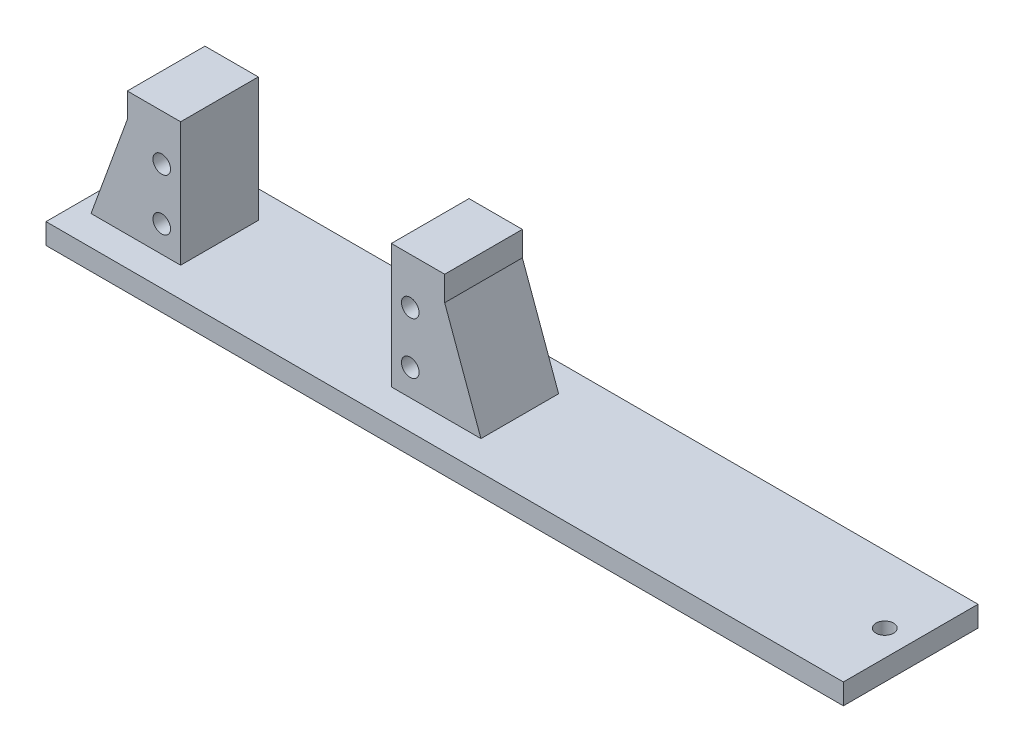
from build123d import *

# Parameters (mm, degrees)
SKETCH1_W           = 154
SKETCH1_H           = 26
SKETCH1_R           = 1.7
BOSS_EXTRUDE1_DEPTH = 4
SKETCH3_W           = 10.3
SKETCH3_H           = 15
BOSS_EXTRUDE2_DEPTH = 24
CHAMFER2_SIZE       = 7
CHAMFER2_SIZE2      = 19.232341936
CHAMFER3_SIZE       = 7
CHAMFER3_SIZE_2     = 19.232341936
SKETCH4_W           = 10
SKETCH4_H           = 10
CUT_EXTRUDE1_DEPTH  = 24
SKETCH6_R           = 1.7
CUT_EXTRUDE2_DEPTH  = 15


with BuildPart() as part:
    # Sketch1 → Boss-Extrude1 (new body)
    with BuildSketch(Plane(origin=(0, 0, 0), x_dir=(1, 0, 0), z_dir=(0, 1, 0))):
        with Locations((0, 66)):
            Rectangle(SKETCH1_W, SKETCH1_H)
        with Locations(Location((72, 66, 0), (0, 0, 270))):
            Circle(SKETCH1_R, mode=Mode.SUBTRACT)
        with Locations(Location((-72, 66, 0), (0, 0, 270))):
            Circle(SKETCH1_R, mode=Mode.SUBTRACT)
    extrude(amount=BOSS_EXTRUDE1_DEPTH)

    # Sketch3 → Boss-Extrude2 (add)
    with BuildSketch(Plane(origin=(0, 4, 0), x_dir=(1, 0, 0), z_dir=(0, 1, 0))):
        with Locations((-61.85, 66.2)):
            Rectangle(SKETCH3_W, SKETCH3_H)
        with Locations((-10.85, 66.2)):
            Rectangle(SKETCH3_W, SKETCH3_H)
    extrude(amount=BOSS_EXTRUDE2_DEPTH)

    # Chamfer2
    chamfer2_edges = [part.edges().sort_by_distance(p)[0] for p in [
        (-5.7, 4, -66.2),
    ]]
    chamfer2_side = [part.faces().sort_by_distance(p)[0] for p in [
        (3.054836525, 4, -65.983192096),
    ]]
    chamfer(chamfer2_edges, length=CHAMFER2_SIZE, length2=CHAMFER2_SIZE2, reference=chamfer2_side[0])

    # Chamfer3
    # the kernel refuses this chamfer: 19.232341936, 7 mm, written as the material it adds along each edge
    with BuildSketch(Plane(origin=(-67, 4, -73.7), x_dir=(-0.9950833631817486, -0.09904090225205066, 0), z_dir=(0, 0, 1))) as chamfer3_piece_1_section:
        Polygon((CHAMFER3_SIZE * 0.995083363182, -CHAMFER3_SIZE * 0.0990409022521), (-CHAMFER3_SIZE_2 * 0.099040902253, -CHAMFER3_SIZE_2 * 0.995083363191), (0, 0), align=None)
    chamfer3_piece_1 = extrude(amount=15, mode=Mode.PRIVATE)
    chamfer3_piece_1 = chamfer3_piece_1 - Plane(origin=(-72, 10.759738183, -66), x_dir=(0, 0, 1), z_dir=(0, -1, 0)) * Cylinder(1.7, 107, mode=Mode.PRIVATE)
    add(chamfer3_piece_1)

    # Sketch4 → Cut-Extrude1 (cut)
    with BuildSketch(Plane(origin=(0, 28, 0), x_dir=(1, 0, 0), z_dir=(0, 1, 0))):
        with Locations((-72, 66)):
            Rectangle(SKETCH4_W, SKETCH4_H)
    extrude(amount=-CUT_EXTRUDE1_DEPTH, mode=Mode.SUBTRACT)

    # Sketch6 → Cut-Extrude2 (cut)
    with BuildSketch(Plane.XY.offset(-58.7)):
        with Locations((-60.35, 9.1)):
            Circle(SKETCH6_R)
        with Locations((-60.35, 19.1)):
            Circle(SKETCH6_R)
        with Locations((-12.35, 9.1)):
            Circle(SKETCH6_R)
        with Locations((-12.35, 19.1)):
            Circle(SKETCH6_R)
    extrude(amount=-CUT_EXTRUDE2_DEPTH, mode=Mode.SUBTRACT)


solid = part.part
